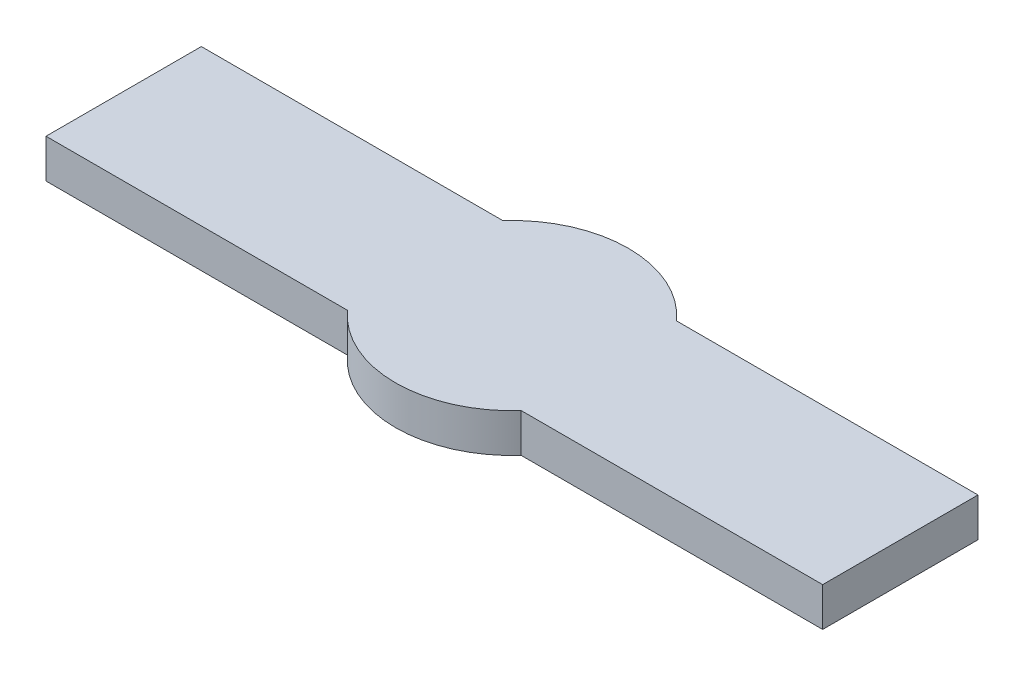
from build123d import *

# Parameters (mm, degrees)
BOSS_EXTRUDE1_DEPTH = 12.7


with BuildPart() as part:
    # Sketch1 → Boss-Extrude1 (new body)
    with BuildSketch(Plane(origin=(0, 0, 0), x_dir=(1, 0, 0), z_dir=(0, 1, 0))):
        with BuildLine():
            Line((-28.398063314, 25.4), (-127, 25.4))
            Line((-127, 25.4), (-127, -25.4))
            Line((-127, -25.4), (-28.398063314, -25.4))
            ThreePointArc((-28.398063314, -25.4), (0, -38.1), (28.398063314, -25.4))
            Line((28.398063314, -25.4), (127, -25.4))
            Line((127, -25.4), (127, 25.4))
            Line((127, 25.4), (28.398063314, 25.4))
            ThreePointArc((28.398063314, 25.4), (0, 38.1), (-28.398063314, 25.4))
        make_face()
    extrude(amount=BOSS_EXTRUDE1_DEPTH)


solid = part.part
